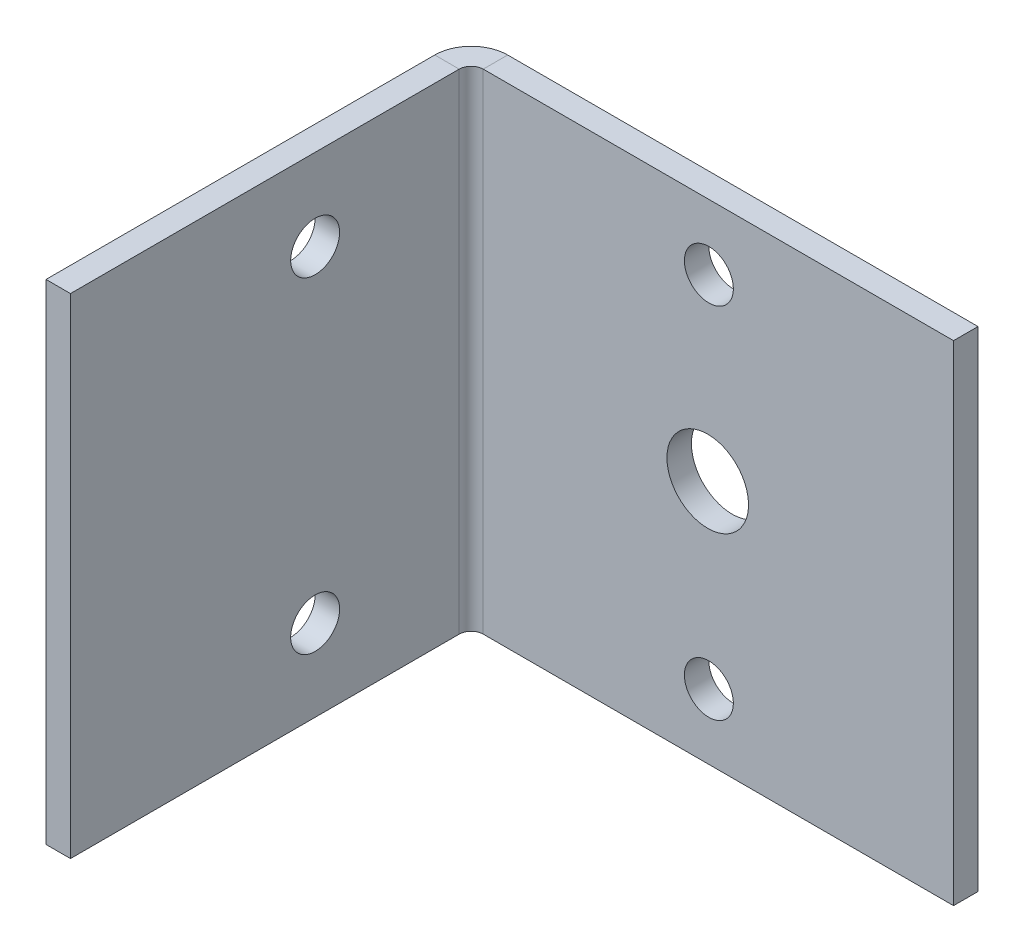
from build123d import *

# Parameters (mm, degrees)
BASE_FLANGE1_DEPTH              = 1.5
SKETCHED_BEND1_DEPTH            = 30
SKETCHED_BEND1_2_DEPTH          = 30
F_5_0MM_PRESS_DOWEL_HOLE1_D     = 5
F_3_0MM_PRESS_DOWEL_HOLE1_D     = 3
F_3_0MM_PRESS_DOWEL_HOLE2_D     = 3
F_3_0MM_PRESS_DOWEL_HOLE3_D     = 3
F_3_0MM_PRESS_DOWEL_HOLE3_DEPTH = 6
F_3_0MM_PRESS_DOWEL_HOLE3_TIP   = 0.901290929


# Read off the part's stored shape, not the designer's step: Sketched Bend1
# Sheet-metal steps are written as plain solids
with BuildPart() as part:
    # Sketch1 → Base-Flange1 (new body)
    with BuildSketch(Plane.XY):
        Polygon((0, 0), (25, 0), (55, 0), (55, 30), (25, 30), (0, 30), align=None)
    extrude(amount=-BASE_FLANGE1_DEPTH)

    # Sketched Bend1 outline → Sketched Bend1 (cut)
    with BuildSketch(Plane(origin=(0, 0, 0), x_dir=(1, 0, 0), z_dir=(0, 1, 0))):
        with BuildLine():
            Line((0, 0), (24.055749054, 0))
            ThreePointArc((24.055749054, 0), (24.872408828, 1.086838938), (26.16757291, 1.5))
            Line((26.16757291, 1.5), (0, 1.5))
            Line((0, 1.5), (0, 0))
        make_face()
    extrude(amount=SKETCHED_BEND1_DEPTH, mode=Mode.SUBTRACT)

    # Sketched Bend1 2 outline → Sketched Bend1 2 (add)
    with BuildSketch(Plane(origin=(0, 0, 0), x_dir=(1, 0, 0), z_dir=(0, 1, 0))):
        with BuildLine():
            ThreePointArc((24.055749054, 0), (23.962387567, -0.363053267), (23.93097291, -0.7366))
            Line((23.93097291, -0.7366), (23.93097291, -24.56902709))
            Line((23.93097291, -24.56902709), (25.43097291, -24.56902709))
            Line((25.43097291, -24.56902709), (25.43097291, -0.7366))
            ThreePointArc((25.43097291, -0.7366), (25.646718055, -0.215745145), (26.16757291, 0))
            Line((26.16757291, 0), (24.055749054, 0))
        make_face()
    extrude(amount=SKETCHED_BEND1_2_DEPTH)

    # Ø5.0mm Press Dowel Hole1 (through all)
    with Locations(Plane(origin=(0, 0, -1.5), x_dir=(-1, 0, 0), z_dir=(0, 0, -1))):
        with Locations((-39.93097291, 15)):
            Hole(F_5_0MM_PRESS_DOWEL_HOLE1_D / 2)

    # Ø3.0mm Press Dowel Hole1 (through all)
    with Locations(Plane(origin=(0, 0, -1.5), x_dir=(-1, 0, 0), z_dir=(0, 0, -1))):
        with Locations((-40, 4), (-40, 26)):
            Hole(F_3_0MM_PRESS_DOWEL_HOLE1_D / 2)

    # Ø3.0mm Press Dowel Hole2 (through all)
    with Locations(Plane(origin=(25.43097291, 0, 0), x_dir=(0, 0, -1), z_dir=(1, 0, 0))):
        with Locations((-9.56902709, 5), (-9.56902709, 25)):
            Hole(F_3_0MM_PRESS_DOWEL_HOLE2_D / 2)

    # Ø3.0mm Press Dowel Hole3
    with Locations(Plane(origin=(23.93097291, -205.525513363, -308.224624397), x_dir=(0, 1, 0), z_dir=(1, 0, 0))):
        with Locations((220.525513363, 156.531359221), (102.525513363, 181.531359221), (102.525513363, 271.531359221), (89.19270005, 226.531359221), (210.525513363, 317.793651488), (230.525513363, 317.793651488), (252.525513363, 320.462332131), (232.525513363, 300.462332131), (252.525513363, 132.600386311), (232.525513363, 152.600386311), (111.286271896, 136.531359221), (91.286271896, 136.531359221), (41.525513363, 196.432813402), (13.525513363, 196.432813402), (41.525513363, 138.767959221), (13.525513363, 138.767959221), (41.525513363, 256.62990504), (13.525513363, 256.62990504), (41.525513363, 314.294759221), (13.525513363, 314.294759221)):
            Hole(F_3_0MM_PRESS_DOWEL_HOLE3_D / 2, depth=F_3_0MM_PRESS_DOWEL_HOLE3_DEPTH)
            with Locations((0, 0, -(F_3_0MM_PRESS_DOWEL_HOLE3_DEPTH + F_3_0MM_PRESS_DOWEL_HOLE3_TIP / 2))):  # 118° drill point
                Cone(0, F_3_0MM_PRESS_DOWEL_HOLE3_D / 2, F_3_0MM_PRESS_DOWEL_HOLE3_TIP, mode=Mode.SUBTRACT)


solid = part.part
